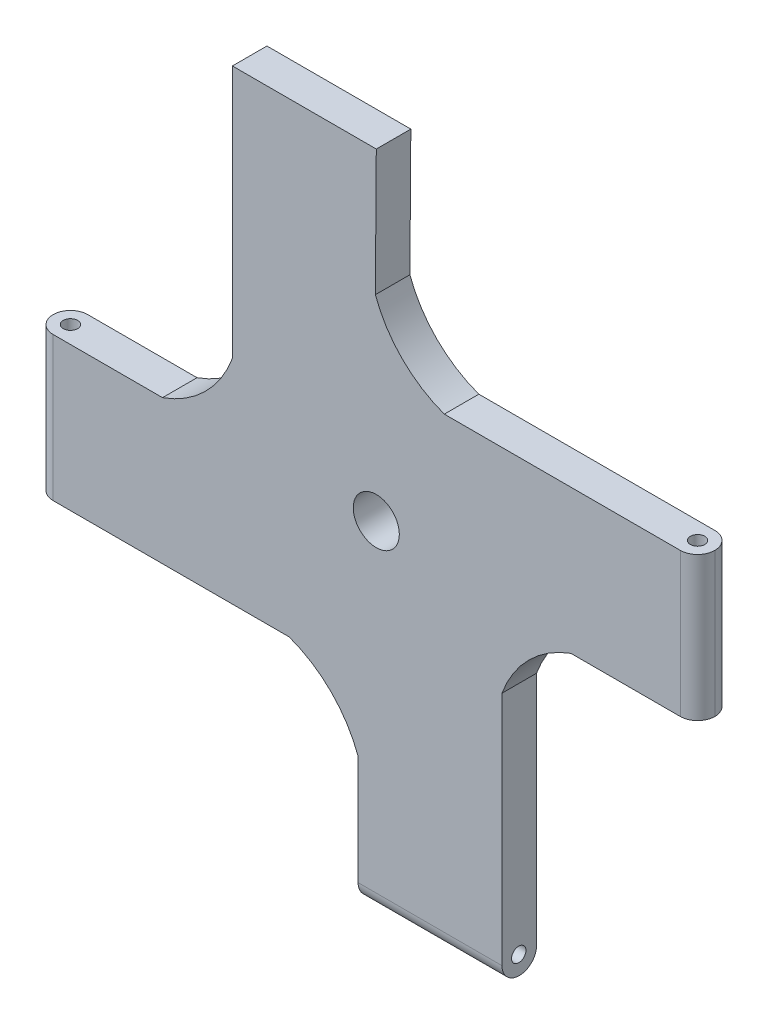
from build123d import *

# Parameters (mm, degrees)
SKETCH_2_R          = 4
EXTRUDE_1_DEPTH     = 6
SKETCH_3_R          = 1.25
CUT_EXTRUDE_1_DEPTH = 5
CUT_EXTRUDE_START   = -5
SKETCH_4_R          = 1.25
CUT_EXTRUDE_2_DEPTH = 5
SKETCH_5_R          = 1.25
CUT_EXTRUDE_3_DEPTH = 5
SKETCH_6_R          = 1.25
CUT_EXTRUDE_4_DEPTH = 5
SKETCH_8_R          = 1.25
CUT_EXTRUDE_5_DEPTH = 5
SKETCH_9_R          = 1.25
CUT_EXTRUDE_6_DEPTH = 5
FILLET_2_R          = 3


with BuildPart() as part:
    # 스케치2 → 보스-돌출1 (new body)
    with BuildSketch(Plane.XY):
        with BuildLine():
            Line((-102.525284978, -57.601148056), (-102.525284978, -32.601148056))
            Line((-102.525284978, -32.601148056), (-80.525284978, -32.601148056))
            ThreePointArc((-80.525284978, -32.601148056), (-73.11411316, -27.970582536), (-68.384824454, -20.622015799))
            Line((-68.384824454, -20.622015799), (-68.384824454, 23.377984201))
            Line((-68.384824454, 23.377984201), (-43.384824454, 23.377984201))
            Line((-43.384824454, 23.377984201), (-43.545565494, 1.378571429))
            ThreePointArc((-43.545565494, 1.378571429), (-38.886846868, -5.94242943), (-31.565846009, -10.601148056))
            Line((-31.565846009, -10.601148056), (12.434153991, -10.601148056))
            Line((12.434153991, -10.601148056), (12.434153991, -35.601148056))
            Line((12.434153991, -35.601148056), (-9.565846009, -35.601148056))
            ThreePointArc((-9.565846009, -35.601148056), (-16.886846868, -40.259866682), (-21.545565494, -47.580867541))
            Line((-21.545565494, -47.580867541), (-21.545565494, -91.580867541))
            Line((-21.545565494, -91.580867541), (-46.545565494, -91.580867541))
            Line((-46.545565494, -91.580867541), (-46.545565494, -69.580867541))
            ThreePointArc((-46.545565494, -69.580867541), (-51.20428412, -62.259866682), (-58.525284978, -57.601148056))
            Line((-58.525284978, -57.601148056), (-102.525284978, -57.601148056))
        make_face()
        with Locations((-43.384824454, -32.601148056)):
            Circle(SKETCH_2_R, mode=Mode.SUBTRACT)
    extrude(amount=EXTRUDE_1_DEPTH)

    # 스케치3 → 컷-돌출1 (cut)
    with BuildSketch(Plane(origin=(0, -57.601148056, 0), x_dir=(-1, 0, 0), z_dir=(0, -1, 0))):
        with Locations(Location((99.525284978, -3, 0), (0, 0, 90))):
            Circle(SKETCH_3_R)
    extrude(amount=-CUT_EXTRUDE_1_DEPTH, mode=Mode.SUBTRACT)

    # 스케치4 → 컷-돌출2 (cut)
    with BuildSketch(Plane(origin=(0, -32.601148056, 0), x_dir=(1, 0, 0), z_dir=(0, 1, 0)).offset(CUT_EXTRUDE_START)):
        with Locations(Location((-99.525284978, -3, 0), (0, 0, 90))):
            Circle(SKETCH_4_R)
    extrude(amount=CUT_EXTRUDE_2_DEPTH, mode=Mode.SUBTRACT)

    # 스케치5 → 컷-돌출3 (cut)
    with BuildSketch(Plane(origin=(-21.545565494, 0, 0), x_dir=(0, 0, -1), z_dir=(1, 0, 0))):
        with Locations(Location((-3.087647422, -88.347802665, 0), (0, 0, 90))):
            Circle(SKETCH_5_R)
    extrude(amount=-CUT_EXTRUDE_3_DEPTH, mode=Mode.SUBTRACT)

    # 스케치6 → 컷-돌출4 (cut)
    with BuildSketch(Plane.ZY.offset(46.545565494).offset(CUT_EXTRUDE_START)):
        with Locations(Location((3.087647422, -88.347802665, 0), (0, 0, 90))):
            Circle(SKETCH_6_R)
    extrude(amount=CUT_EXTRUDE_4_DEPTH, mode=Mode.SUBTRACT)

    # 스케치8 → 컷-돌출5 (cut)
    with BuildSketch(Plane(origin=(0, -10.601148056, 0), x_dir=(1, 0, 0), z_dir=(0, 1, 0))):
        with Locations(Location((9.434153991, -3, 0), (0, 0, 180))):
            Circle(SKETCH_8_R)
    extrude(amount=-CUT_EXTRUDE_5_DEPTH, mode=Mode.SUBTRACT)

    # 스케치9 → 컷-돌출6 (cut)
    with BuildSketch(Plane(origin=(0, -35.601148056, 0), x_dir=(-1, 0, 0), z_dir=(0, -1, 0)).offset(CUT_EXTRUDE_START)):
        with Locations((-9.434153991, -3)):
            Circle(SKETCH_9_R)
    extrude(amount=CUT_EXTRUDE_6_DEPTH, mode=Mode.SUBTRACT)

    # 필렛2
    fillet_2_edges = [part.edges().sort_by_distance(p)[0] for p in [
        (12.434153991, -23.101148056, 0),
        (12.434153991, -23.101148056, 6),
        (-34.045565494, -91.580867541, 0),
        (-34.045565494, -91.580867541, 6),
        (-102.525284978, -45.101148056, 0),
        (-102.525284978, -45.101148056, 6),
    ]]
    fillet(fillet_2_edges, radius=FILLET_2_R - 0.0001)  # a hair under: the kernel refuses the full size


solid = part.part
